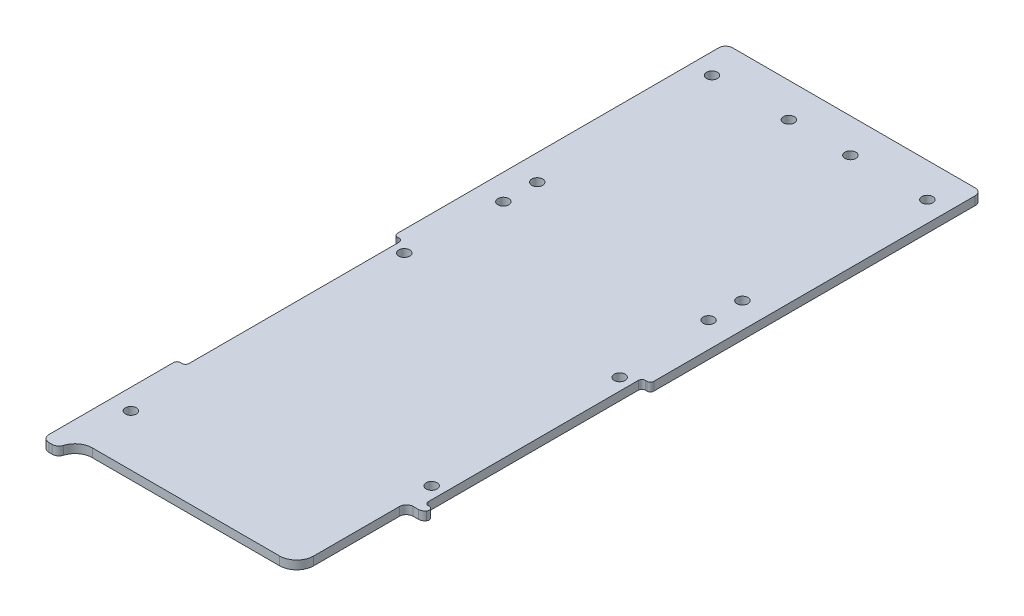
from build123d import *

# Parameters (mm, degrees)
SKETCH1_R               = 2.032
BOSS_EXTRUDE1_DEPTH     = 3.175
FILLET1_R               = 2.54
FILLET2_R               = 2.54
FILLET3_R               = 6.35
CUT_EXTRUDE1_DEPTH      = 136.673215063
FILLET4_R               = 6.35
FILLET5_R               = 2.54
SKETCH3_R               = 2.032
CUT_EXTRUDE2_DEPTH      = 136.673215063
CUT_EXTRUDE3_DEPTH      = 136.673215063
CUT_EXTRUDE3_DEPTH_BACK = 136.673215063
SKETCH4_W               = 3.175
SKETCH4_H               = 80.645
FILLET6_R               = 1.27


with BuildPart() as part:
    # Sketch1 → Boss-Extrude1 (new body)
    with BuildSketch(Plane(origin=(0, 0, 0), x_dir=(1, 0, 0), z_dir=(0, 1, 0))):
        Polygon((47.625, 127), (-47.625, 127), (-47.625, -127), (-41.275, -127), (-41.275, -120.65), (41.275, -120.65), (41.275, -127), (47.625, -127), align=None)
        with Locations((-39.999684148, -101.6)):
            Circle(SKETCH1_R, mode=Mode.SUBTRACT)
        with Locations((39.999684148, -69.85)):
            Circle(SKETCH1_R, mode=Mode.SUBTRACT)
        with Locations((-39.999684148, 0)):
            Circle(SKETCH1_R, mode=Mode.SUBTRACT)
        with Locations((-39.999684148, 114.3)):
            Circle(SKETCH1_R, mode=Mode.SUBTRACT)
        with Locations((-11.424684148, 114.3)):
            Circle(SKETCH1_R, mode=Mode.SUBTRACT)
        with Locations((39.999684148, 0)):
            Circle(SKETCH1_R, mode=Mode.SUBTRACT)
        with Locations((11.424684148, 114.3)):
            Circle(SKETCH1_R, mode=Mode.SUBTRACT)
        with Locations((39.999684148, 114.3)):
            Circle(SKETCH1_R, mode=Mode.SUBTRACT)
    extrude(amount=BOSS_EXTRUDE1_DEPTH)

    # Fillet1
    fillet1_edges = [part.edges().sort_by_distance(p)[0] for p in [
        (-47.625, 1.5875, -127),
        (47.625, 1.5875, -127),
        (47.625, 1.5875, 127),
        (-47.625, 1.5875, 127),
    ]]
    fillet(fillet1_edges, radius=FILLET1_R)

    # Fillet2
    fillet2_edges = [part.edges().sort_by_distance(p)[0] for p in [
        (41.275, 1.5875, 127),
        (-41.275, 1.5875, 127),
    ]]
    fillet(fillet2_edges, radius=FILLET2_R)

    # Fillet3
    fillet3_edges = [part.edges().sort_by_distance(p)[0] for p in [
        (41.275, 1.5875, 120.65),
        (-41.275, 1.5875, 120.65),
    ]]
    fillet(fillet3_edges, radius=FILLET3_R)

    # Sketch2 → Cut-Extrude1 (cut, through all)
    with BuildSketch(Plane.XZ):
        with BuildLine():
            Line((40.64508, 123.578690235), (40.64508, 79.88808))
            Line((40.64508, 79.88808), (47.625, 79.88808))
            Line((47.625, 79.88808), (47.625, 124.46))
            ThreePointArc((47.625, 124.46), (46.881051224, 126.256051224), (45.085, 127))
            Line((45.085, 127), (43.815, 127))
            ThreePointArc((43.815, 127), (42.297059666, 126.496530663), (41.380880287, 125.185714286))
            ThreePointArc((41.380880287, 125.185714286), (41.069166069, 124.356476684), (40.64508, 123.578690235))
        make_face()
    extrude(amount=-CUT_EXTRUDE1_DEPTH, mode=Mode.SUBTRACT)

    # Fillet4
    fillet4_edges = [part.edges().sort_by_distance(p)[0] for p in [
        (40.64508, 1.5875, 123.578690235),
    ]]
    fillet(fillet4_edges, radius=FILLET4_R)

    # Fillet5
    fillet5_edges = [part.edges().sort_by_distance(p)[0] for p in [
        (47.625, 1.5875, 79.88808),
        (40.64508, 1.5875, 79.88808),
    ]]
    fillet(fillet5_edges, radius=FILLET5_R)

    # Sketch3 → Cut-Extrude2 (cut, through all)
    with BuildSketch(Plane.XZ):
        with Locations((-38.10951357, -34.913768806)):
            Circle(SKETCH3_R)
        with Locations((-38.10951357, -47.490173279)):
            Circle(SKETCH3_R)
        with Locations((38.10951357, -47.490173279)):
            Circle(SKETCH3_R)
        with Locations((38.10951357, -34.913768806)):
            Circle(SKETCH3_R)
    extrude(amount=-CUT_EXTRUDE2_DEPTH, mode=Mode.SUBTRACT)

    # Sketch4 → Cut-Extrude3 (cut, two sides: drawn at the far end of the back side and taken through both)
    with BuildSketch(Plane(origin=(0, 3.175, 0), x_dir=(1, 0, 0), z_dir=(0, 1, 0)).offset(-CUT_EXTRUDE3_DEPTH_BACK)):
        with Locations((-46.0375, -36.5125)):
            Rectangle(SKETCH4_W, SKETCH4_H)
        with Locations((46.0375, -36.5125)):
            Rectangle(SKETCH4_W, SKETCH4_H)
    extrude(amount=CUT_EXTRUDE3_DEPTH + CUT_EXTRUDE3_DEPTH_BACK, mode=Mode.SUBTRACT)

    # Fillet6
    fillet6_edges = [part.edges().sort_by_distance(p)[0] for p in [
        (-44.45, 1.5875, -3.81),
        (-47.625, 1.5875, -3.81),
        (-47.625, 1.5875, 76.835),
        (-44.45, 1.5875, 76.835),
        (44.45, 1.5875, 76.835),
        (47.625, 1.5875, 76.835),
        (44.45, 1.5875, -3.81),
        (47.625, 1.5875, -3.81),
    ]]
    fillet(fillet6_edges, radius=FILLET6_R)


solid = part.part
